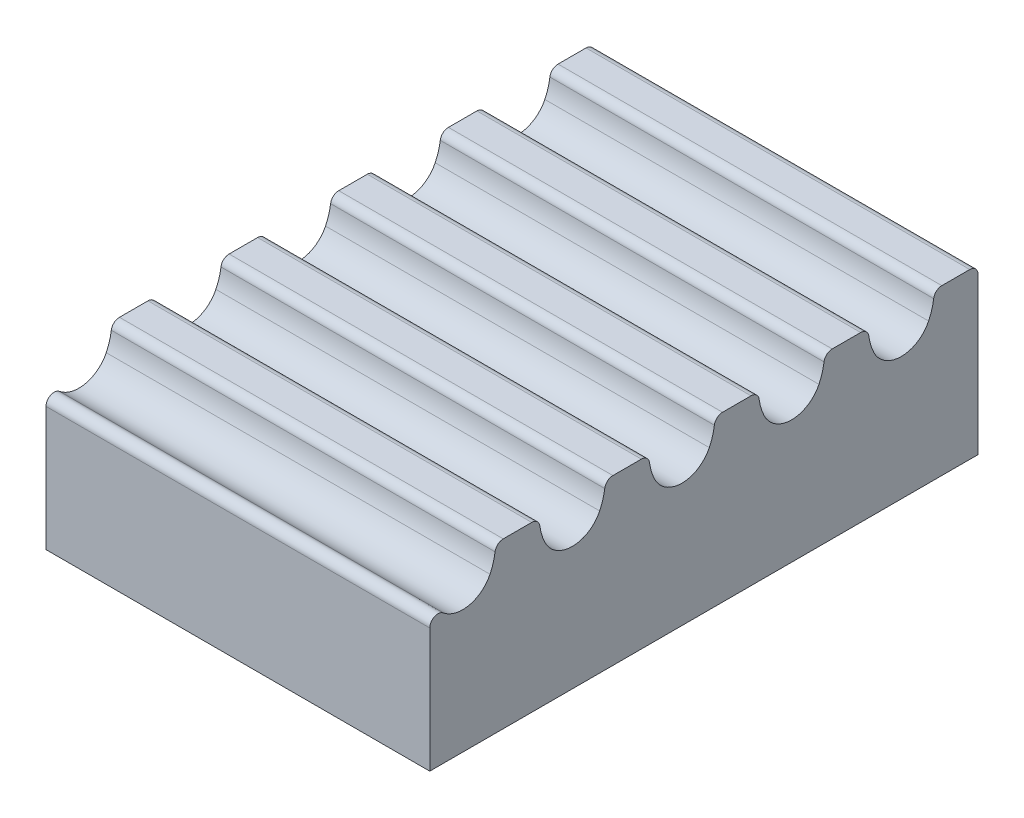
from build123d import *

# Parameters (mm, degrees)
SKETCH2_W           = 10
SKETCH2_H           = 3
BOSS_EXTRUDE1_DEPTH = 7
CUT_EXTRUDE2_DEPTH  = 13.56980509
LPATTERN2_COUNT     = 10
LPATTERN2_PITCH     = 2
FILLET2_START       = -1
FILLET2_DEPTH       = 9


with BuildPart() as part:
    # Sketch2 → Boss-Extrude1 (new body)
    with BuildSketch(Plane(origin=(0, 0, 0), x_dir=(0, 0, -1), z_dir=(1, 0, 0))):
        with Locations((5, -1.5)):
            Rectangle(SKETCH2_W, SKETCH2_H)
    extrude(amount=BOSS_EXTRUDE1_DEPTH)

    # Sketch1 → Cut-Extrude2 (cut, through all)
    with BuildSketch(Plane(origin=(0, 0, 0), x_dir=(0, 0, -1), z_dir=(1, 0, 0))):
        with BuildLine():
            ThreePointArc((0.10112359, -0.438202237), (0.045620517, -0.221237163), (0.080384758, 0))
            Line((0.080384758, 0), (0, 0))
            ThreePointArc((0, 0), (0.025608803, -0.224859501), (0.10112359, -0.438202237))
        make_face()
        with BuildLine():
            ThreePointArc((1.155, -0.195), (1.146082164, -0.095907769), (1.119615242, 0))
            Line((1.119615242, 0), (0.080384758, 0))
            ThreePointArc((0.080384758, 0), (0.045620517, -0.221237163), (0.10112359, -0.438202237))
            ThreePointArc((0.10112359, -0.438202237), (0.6, -0.75), (1.09887641, -0.438202237))
            ThreePointArc((1.09887641, -0.438202237), (1.140787115, -0.319797021), (1.155, -0.195))
        make_face()
        with BuildLine():
            Line((0.080384758, 0), (1.119615242, 0))
            ThreePointArc((1.119615242, 0), (0.6, 0.36), (0.080384758, 0))
        make_face()
        with BuildLine():
            ThreePointArc((1.09887641, -0.438202237), (1.174391197, -0.224859501), (1.2, 0))
            Line((1.2, 0), (1.119615242, 0))
            ThreePointArc((1.119615242, 0), (1.146082164, -0.095907769), (1.155, -0.195))
            ThreePointArc((1.155, -0.195), (1.140787115, -0.319797021), (1.09887641, -0.438202237))
        make_face()
    cut_extrude2 = extrude(amount=CUT_EXTRUDE2_DEPTH, mode=Mode.SUBTRACT)

    # LPattern2: Cut-Extrude2 ×10
    with Locations(*[(0, 0, -i * LPATTERN2_PITCH) for i in range(1, LPATTERN2_COUNT)]):
        add(cut_extrude2, mode=Mode.SUBTRACT)

    # Fillet2: read off the stored shape, not the designer's step
    # Fillet2 outline → Fillet2 (cut)
    with BuildSketch(Plane.YZ.offset(FILLET2_START)):
        with BuildLine():
            Line((0, -10), (0, -9.85))
            ThreePointArc((0, -9.85), (-0.043933983, -9.956066017), (-0.15, -10))
            Line((-0.15, -10), (0, -10))
        make_face()
        with BuildLine():
            ThreePointArc((-0.130434783, -9.191456891), (-0.037228588, -9.241268354), (0, -9.340175425))
            Line((0, -9.340175425), (0, -9.2))
            ThreePointArc((0, -9.2), (-0.065357129, -9.197861937), (-0.130434783, -9.191456891))
        make_face()
        with BuildLine():
            Line((0, -8), (0, -7.859824575))
            ThreePointArc((0, -7.859824575), (-0.037228588, -7.958731646), (-0.130434783, -8.008543109))
            ThreePointArc((-0.130434783, -8.008543109), (-0.065357129, -8.002138063), (0, -8))
        make_face()
        with BuildLine():
            ThreePointArc((-0.130434783, -7.191456891), (-0.037228588, -7.241268354), (0, -7.340175425))
            Line((0, -7.340175425), (0, -7.2))
            ThreePointArc((0, -7.2), (-0.065357129, -7.197861937), (-0.130434783, -7.191456891))
        make_face()
        with BuildLine():
            Line((0, -6), (0, -5.859824575))
            ThreePointArc((0, -5.859824575), (-0.037228588, -5.958731646), (-0.130434783, -6.008543109))
            ThreePointArc((-0.130434783, -6.008543109), (-0.065357129, -6.002138063), (0, -6))
        make_face()
        with BuildLine():
            ThreePointArc((-0.130434783, -5.191456891), (-0.037228588, -5.241268354), (0, -5.340175425))
            Line((0, -5.340175425), (0, -5.2))
            ThreePointArc((0, -5.2), (-0.065357129, -5.197861937), (-0.130434783, -5.191456891))
        make_face()
        with BuildLine():
            Line((0, -4), (0, -3.859824575))
            ThreePointArc((0, -3.859824575), (-0.037228588, -3.958731646), (-0.130434783, -4.008543109))
            ThreePointArc((-0.130434783, -4.008543109), (-0.065357129, -4.002138063), (0, -4))
        make_face()
        with BuildLine():
            ThreePointArc((-0.130434783, -3.191456891), (-0.037228588, -3.241268354), (0, -3.340175425))
            Line((0, -3.340175425), (0, -3.2))
            ThreePointArc((0, -3.2), (-0.065357129, -3.197861937), (-0.130434783, -3.191456891))
        make_face()
        with BuildLine():
            Line((0, -2), (0, -1.859824575))
            ThreePointArc((0, -1.859824575), (-0.037228588, -1.958731646), (-0.130434783, -2.008543109))
            ThreePointArc((-0.130434783, -2.008543109), (-0.065357129, -2.002138063), (0, -2))
        make_face()
        with BuildLine():
            ThreePointArc((-0.737701575, 0), (-0.601941305, -0.086210119), (-0.622233155, -0.245744681))
            ThreePointArc((-0.622233155, -0.245744681), (-0.537928158, -0.163622551), (-0.438202247, -0.101123596))
            ThreePointArc((-0.438202247, -0.101123596), (-0.224859507, -0.025608804), (0, 0))
            Line((0, 0), (-0.737701575, 0))
        make_face()
        with BuildLine():
            ThreePointArc((-0.130434783, -1.191456891), (-0.037228588, -1.241268354), (0, -1.340175425))
            Line((0, -1.340175425), (0, -1.2))
            ThreePointArc((0, -1.2), (-0.065357129, -1.197861937), (-0.130434783, -1.191456891))
        make_face()
    extrude(amount=FILLET2_DEPTH, mode=Mode.SUBTRACT)


solid = part.part
